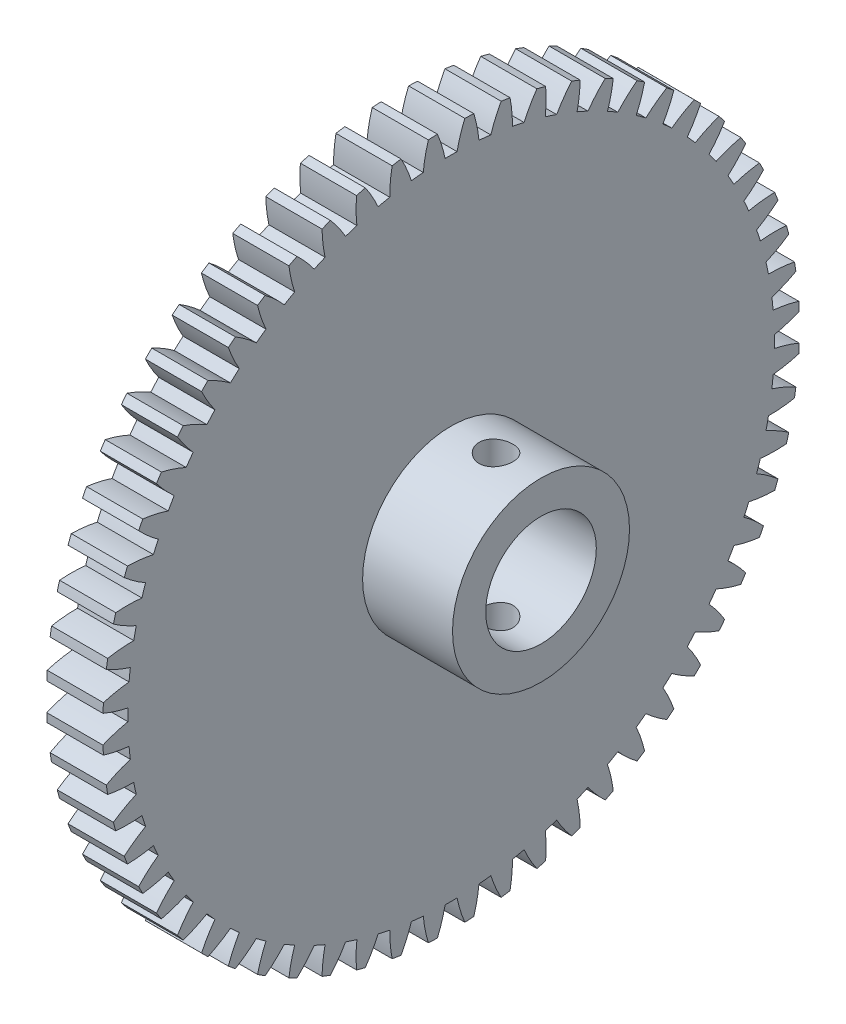
from build123d import *

# Parameters (mm, degrees)
BASPROSKE_W             = 6.35
BASPROSKE_H             = 39.37
TOOTHCUT_DEPTH          = 57.038525141
TEETHCUTS_COUNT         = 60
TEETHCUTS_ANGLE         = 354
BORSKE_R                = 6.25
BORE_DEPTH              = 50.8000508
BOSS_EXTRUDE1_START     = 10.16
SKETCH1_R               = 10
SKETCH1_R_2             = 6.25
BOSS_EXTRUDE1_DEPTH     = 10.16
CUT_EXTRUDE1_DEPTH      = 59.032440751
CUT_EXTRUDE1_DEPTH_BACK = 59.032440751
SKETCH2_R               = 1.905


with BuildPart() as part:
    # BasProSke → Base-Revolve (revolve)
    with BuildSketch(Plane(origin=(0, 0, 0), x_dir=(1, 0, 0), z_dir=(0, 1, 0))):
        with Locations((3.175, 19.685)):
            Rectangle(BASPROSKE_W, BASPROSKE_H)
    revolve(axis=Axis((-10, 0, 0), (1, 0, 0)))

    # TooCutSke → ToothCut (cut, through all)
    with BuildSketch(Plane(origin=(0, 0, 0), x_dir=(0, 0, -1), z_dir=(1, 0, 0))):
        with BuildLine():
            ThreePointArc((0.674018167, 36.51898047), (0, 36.5252), (-0.674018167, 36.51898047))
            ThreePointArc((-0.674018167, 36.51898047), (-1.047934425, 37.963458687), (-1.561312288, 39.364449))
            ThreePointArc((-1.561312288, 39.364449), (0, 39.3954), (1.561312288, 39.364449))
            ThreePointArc((1.561312288, 39.364449), (1.047934425, 37.963458687), (0.674018167, 36.51898047))
        make_face()
    toothcut = extrude(amount=TOOTHCUT_DEPTH, mode=Mode.SUBTRACT)

    # TeethCuts: ToothCut ×60 about axis
    teethcuts_axis = Axis((-10, 0, 0), (1, 0, 0))
    for i in range(1, TEETHCUTS_COUNT):
        add(toothcut.rotate(teethcuts_axis, i * TEETHCUTS_ANGLE / (TEETHCUTS_COUNT - 1)), mode=Mode.SUBTRACT)

    # BorSke → Bore (cut, symmetric)
    with BuildSketch(Plane(origin=(0, 0, 0), x_dir=(0, 0, -1), z_dir=(1, 0, 0))):
        Circle(BORSKE_R)
    extrude(amount=BORE_DEPTH, both=True, mode=Mode.SUBTRACT)

    # Sketch1 → Boss-Extrude1 (add)
    with BuildSketch(Plane(origin=(6.35, 0, 0), x_dir=(0, 0, -1), z_dir=(1, 0, 0)).offset(BOSS_EXTRUDE1_START)):
        Circle(SKETCH1_R)
        Circle(SKETCH1_R_2, mode=Mode.SUBTRACT)
    extrude(amount=-BOSS_EXTRUDE1_DEPTH)

    # Sketch2 → Cut-Extrude1 (cut, two sides: drawn at the far end of the back side and taken through both)
    with BuildSketch(Plane(origin=(0, 0, 0), x_dir=(1, 0, 0), z_dir=(0, 1, 0)).offset(-CUT_EXTRUDE1_DEPTH_BACK)):
        with Locations((11.43, 0)):
            Circle(SKETCH2_R)
    extrude(amount=CUT_EXTRUDE1_DEPTH + CUT_EXTRUDE1_DEPTH_BACK, mode=Mode.SUBTRACT)


solid = part.part
